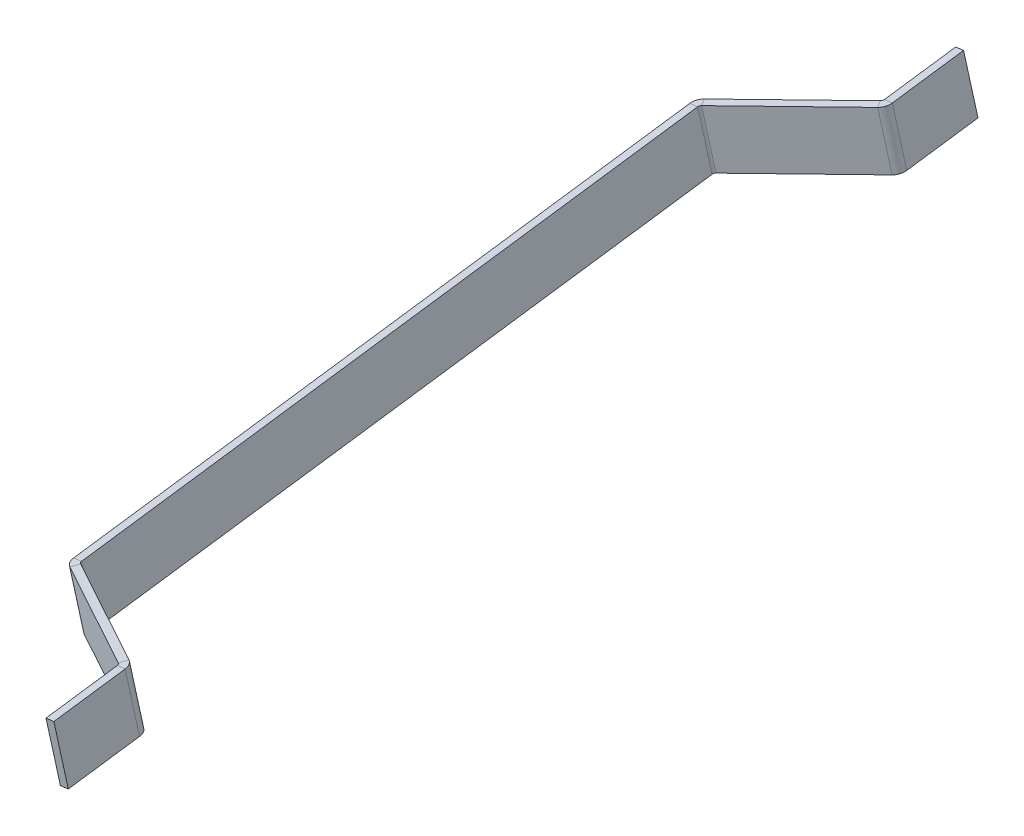
from build123d import *

# Parameters (mm, degrees)
SKETCH2_W                    = 160
SKETCH2_H                    = 15
BASE_FLANGE1_DEPTH           = 2
EDGE_FLANGE1_STRIP_CUT_DEPTH = 15
EDGE_FLANGE1_DEPTH           = 15
EDGE_FLANGE2_STRIP_CUT_DEPTH = 15
EDGE_FLANGE2_DEPTH           = 15
EDGE_FLANGE3_STRIP_CUT_DEPTH = 15
EDGE_FLANGE3_DEPTH           = 15
EDGE_FLANGE4_STRIP_CUT_DEPTH = 15
EDGE_FLANGE4_DEPTH           = 15


# Sheet-metal steps are written as plain solids
with BuildPart() as part:
    # Sketch2 → Base-Flange1 (new body)
    with BuildSketch(Plane(origin=(48.130685362, 5.909705068, 0), x_dir=(0.014852136862004454, -0.1209609477998444, 0.9925461516413208), z_dir=(-0.9925461516413208, -0.12186934340515826, 0))):
        with Locations((80, -7.5)):
            Rectangle(SKETCH2_W, SKETCH2_H)
    extrude(amount=-BASE_FLANGE1_DEPTH)

    # Edge-Flange1 strip (across the edge) → Edge-Flange1 strip cut (cut)
    with BuildSketch(Plane(origin=(51.930191883, -8.623774192, -1.828040151), x_dir=(0.5091354036436435, -0.04382058195792874, 0.8595701817498632), z_dir=(-0.1209609477998443, 0.9851478631379957, 0.1218693434051582))):
        Polygon((-8.835731855, 2.791911088), (-0.6317, -1.944688912), (0.3683, -0.212638104), (-7.835731855, 4.523961896), align=None)
    extrude(amount=EDGE_FLANGE1_STRIP_CUT_DEPTH, mode=Mode.SUBTRACT)

    # Edge-Flange1 section (across the edge) → Edge-Flange1 (add)
    with BuildSketch(Plane(origin=(51.930191883, -8.623774192, -1.828040151), x_dir=(0.5091354036436435, -0.04382058195792874, 0.8595701817498632), z_dir=(-0.1209609477998443, 0.9851478631379957, 0.1218693434051582))):
        with BuildLine():
            Line((-2, 0.425276208), (-2, 33.845299462))
            Line((-2, 33.845299462), (0, 33.845299462))
            Line((0, 33.845299462), (0, 0.425276208))
            ThreePointArc((0, 0.425276208), (0.098685688, 0.056976208), (0.3683, -0.212638104))
            Line((0.3683, -0.212638104), (-0.6317, -1.944688912))
            ThreePointArc((-0.6317, -1.944688912), (-1.63336512, -0.943023792), (-2, 0.425276208))
        make_face()
    extrude(amount=EDGE_FLANGE1_DEPTH)

    # Edge-Flange2 strip (across the edge) → Edge-Flange2 strip cut (cut)
    with BuildSketch(Plane(origin=(77.938579558, 11.860163483, -18.515651229), x_dir=(-0.9925461516413208, -0.12186934340515852, 0), z_dir=(0.12096094779984468, -0.9851478631379958, -0.12186934340515816))):
        Polygon((-8.835731855, 2.791911088), (-0.6317, -1.944688912), (0.3683, -0.212638104), (-7.835731855, 4.523961896), align=None)
    extrude(amount=EDGE_FLANGE2_STRIP_CUT_DEPTH, mode=Mode.SUBTRACT)

    # Edge-Flange2 section (across the edge) → Edge-Flange2 (add)
    with BuildSketch(Plane(origin=(77.938579558, 11.860163483, -18.515651229), x_dir=(-0.9925461516413208, -0.12186934340515852, 0), z_dir=(0.12096094779984468, -0.9851478631379958, -0.12186934340515816))):
        with BuildLine():
            Line((-2, 0.425276208), (-2, 18.845299462))
            Line((-2, 18.845299462), (0, 18.845299462))
            Line((0, 18.845299462), (0, 0.425276208))
            ThreePointArc((0, 0.425276208), (0.098685688, 0.056976208), (0.3683, -0.212638104))
            Line((0.3683, -0.212638104), (-0.6317, -1.944688912))
            ThreePointArc((-0.6317, -1.944688912), (-1.63336512, -0.943023792), (-2, 0.425276208))
        make_face()
    extrude(amount=EDGE_FLANGE2_DEPTH)

    # Edge-Flange3 strip (across the edge) → Edge-Flange3 strip cut (cut)
    with BuildSketch(Plane(origin=(52.492119564, -13.200307893, 158.807384263), x_dir=(0.48341074799768535, 0.16568992536308802, -0.8595701817498632), z_dir=(0.12096094779984425, -0.9851478631379958, -0.1218693434051584))):
        Polygon((-8.835731855, 2.791911088), (-0.6317, -1.944688912), (0.3683, -0.212638104), (-7.835731855, 4.523961896), align=None)
    extrude(amount=EDGE_FLANGE3_STRIP_CUT_DEPTH, mode=Mode.SUBTRACT)

    # Edge-Flange3 section (across the edge) → Edge-Flange3 (add)
    with BuildSketch(Plane(origin=(52.492119564, -13.200307893, 158.807384263), x_dir=(0.48341074799768535, 0.16568992536308802, -0.8595701817498632), z_dir=(0.12096094779984425, -0.9851478631379958, -0.1218693434051584))):
        with BuildLine():
            Line((-2, 0.425276208), (-2, 33.845299462))
            Line((-2, 33.845299462), (0, 33.845299462))
            Line((0, 33.845299462), (0, 0.425276208))
            ThreePointArc((0, 0.425276208), (0.098685688, 0.056976208), (0.3683, -0.212638104))
            Line((0.3683, -0.212638104), (-0.6317, -1.944688912))
            ThreePointArc((-0.6317, -1.944688912), (-1.63336512, -0.943023792), (-2, 0.425276208))
        make_face()
    extrude(amount=EDGE_FLANGE3_DEPTH)

    # Edge-Flange4 strip (across the edge) → Edge-Flange4 strip cut (cut)
    with BuildSketch(Plane(origin=(82.683460004, -26.783786628, 175.494995341), x_dir=(-0.9925461516413208, -0.12186934340515758, 0), z_dir=(-0.12096094779984379, 0.9851478631379957, 0.12186934340515838))):
        Polygon((-8.835731855, 2.791911088), (-0.6317, -1.944688912), (0.3683, -0.212638104), (-7.835731855, 4.523961896), align=None)
    extrude(amount=EDGE_FLANGE4_STRIP_CUT_DEPTH, mode=Mode.SUBTRACT)

    # Edge-Flange4 section (across the edge) → Edge-Flange4 (add)
    with BuildSketch(Plane(origin=(82.683460004, -26.783786628, 175.494995341), x_dir=(-0.9925461516413208, -0.12186934340515758, 0), z_dir=(-0.12096094779984379, 0.9851478631379957, 0.12186934340515838))):
        with BuildLine():
            Line((-2, 0.425276208), (-2, 18.845299462))
            Line((-2, 18.845299462), (0, 18.845299462))
            Line((0, 18.845299462), (0, 0.425276208))
            ThreePointArc((0, 0.425276208), (0.098685688, 0.056976208), (0.3683, -0.212638104))
            Line((0.3683, -0.212638104), (-0.6317, -1.944688912))
            ThreePointArc((-0.6317, -1.944688912), (-1.63336512, -0.943023792), (-2, 0.425276208))
        make_face()
    extrude(amount=EDGE_FLANGE4_DEPTH)


solid = part.part
